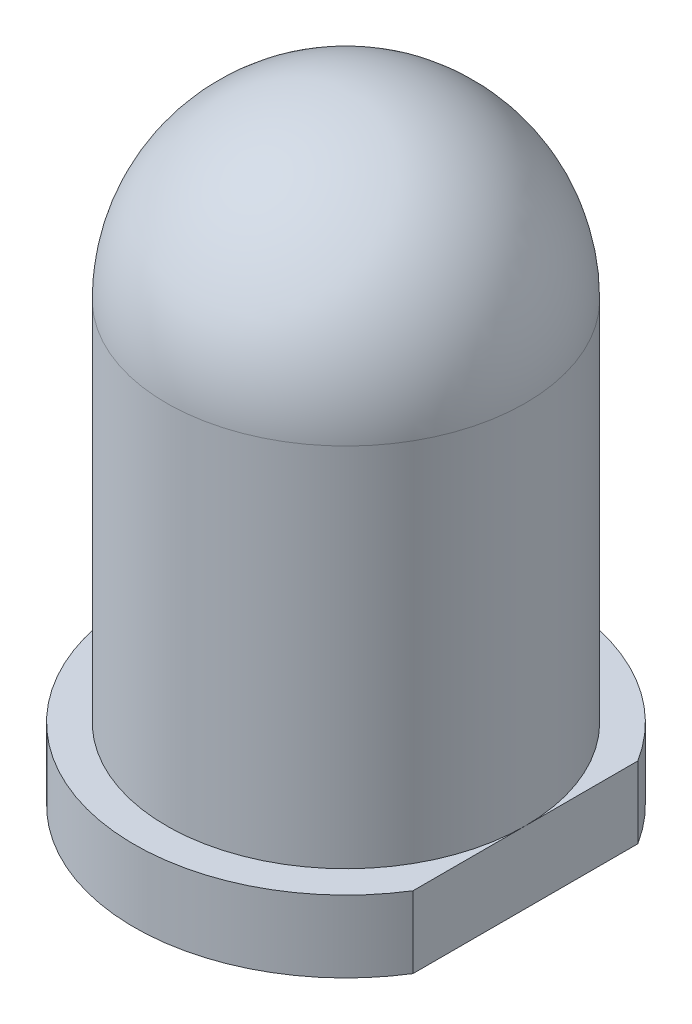
from build123d import *

# Parameters (mm, degrees)
FLANGE_DEPTH = 1


with BuildPart() as part:
    # Body Profile → Body (revolve)
    with BuildSketch(Plane.XY):
        with BuildLine():
            Line((2.5, 5.1), (2.5, 0))
            Line((2.5, 0), (0, 0))
            Line((0, 0), (0, 7.6))
            ThreePointArc((0, 7.6), (1.767766953, 6.867766953), (2.5, 5.1))
        make_face()
    revolve(axis=Axis((0, -170.01390881, 0), (0, 1, 0)))

    # Flange Outline → Flange (add)
    with BuildSketch(Plane.XZ):
        with BuildLine():
            Line((2.5, -1.566045976), (2.5, 1.566045976))
            ThreePointArc((2.5, 1.566045976), (-2.95, 0), (2.5, -1.566045976))
        make_face()
    extrude(amount=FLANGE_DEPTH)


solid = part.part
